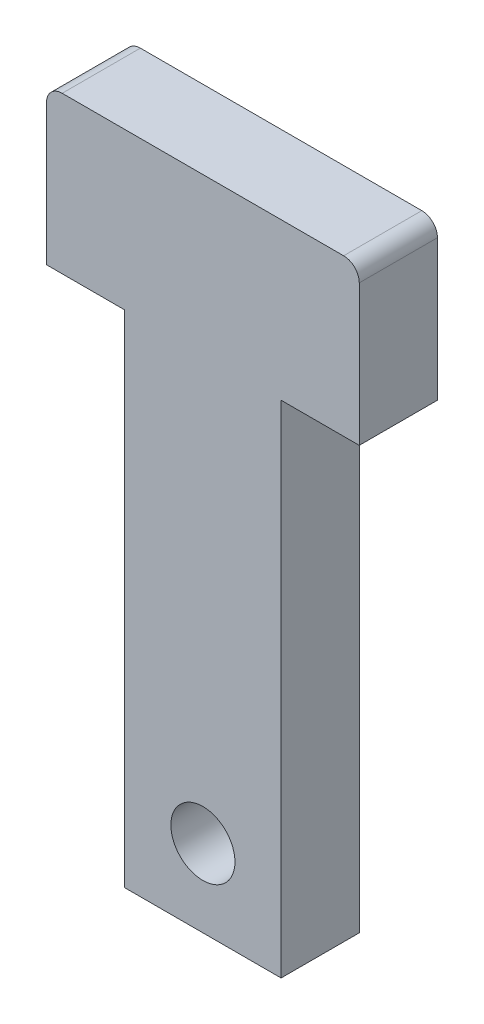
from build123d import *

# Parameters (mm, degrees)
SKETCH_1_R      = 2.05
EXTRUDE_1_DEPTH = 5


with BuildPart() as part:
    # 草圖1 → 填料-伸長1 (new body)
    with BuildSketch(Plane.XY):
        with BuildLine():
            Line((-5, -4.5), (-10, -4.5))
            Line((-10, -4.5), (-10, 4.5))
            ThreePointArc((-10, 4.5), (-9.707106781, 5.207106781), (-9, 5.5))
            Line((-9, 5.5), (9, 5.5))
            ThreePointArc((9, 5.5), (9.707106781, 5.207106781), (10, 4.5))
            Line((10, 4.5), (10, -4.5))
            Line((10, -4.5), (5, -4.5))
            Line((5, -4.5), (5, -36.5))
            Line((5, -36.5), (-5, -36.5))
            Line((-5, -36.5), (-5, -4.5))
        make_face()
        with Locations((0, -31.55)):
            Circle(SKETCH_1_R, mode=Mode.SUBTRACT)
    extrude(amount=EXTRUDE_1_DEPTH)


solid = part.part
